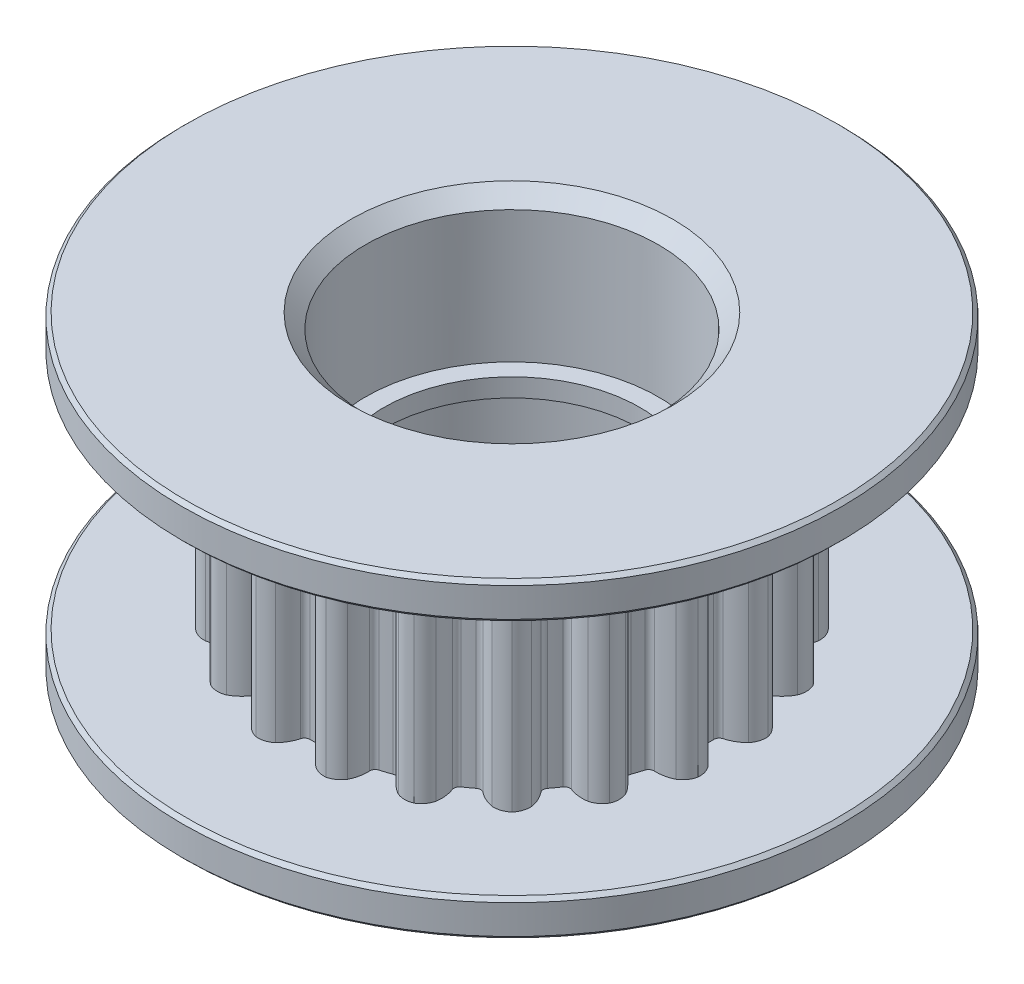
from build123d import *

# Parameters (mm, degrees)
GT2PROFILE_REACH             = 15.419
GT2PROFILE_DIRECTION_2_REACH = 15.419
GT2_GROOVE_CP_COUNT          = 20
INNERC_SIZE                  = 0.4
OUTERC_SIZE                  = 0.1


with BuildPart() as part:
    # BodyS → Body (revolve)
    with BuildSketch(Plane.XY):
        Polygon((6.11, -3.25), (6.11, 3.25), (9, 3.25), (9, 4.25), (4, 4.25), (4, 0.25), (3.5, 0.25), (3.5, -0.25), (4, -0.25), (4, -4.25), (9, -4.25), (9, -3.25), align=None)
    revolve(axis=Axis((0, 4.25, 0), (0, -1, 0)))

    # GT2Profile: up to this face of the body (flat: up to its plane)
    gt2profile_end = Plane(part.part.faces().sort_by_distance((-8.745441559, -3.25, 0))[0])
    # GT2ProfileS → GT2Profile (cut, up to the picked face)
    with BuildSketch(Plane(origin=(0, 0, 0), x_dir=(1, 0, 0), z_dir=(0, 1, 0)), mode=Mode.PRIVATE) as gt2profile_sk1:
        with BuildLine():
            ThreePointArc((0.299749921, -5.468781955), (0.244461347, -5.387479579), (0.150701934, -5.357881011))
            ThreePointArc((0.150701934, -5.357881011), (0, -5.36), (-0.150701934, -5.357881011))
            ThreePointArc((-0.150701934, -5.357881011), (-0.244461347, -5.387479579), (-0.299749921, -5.468781955))
            ThreePointArc((-0.299749921, -5.468781955), (-0.396626607, -5.703924717), (-0.549685833, -5.907025885))
            ThreePointArc((-0.549685833, -5.907025885), (-0.7593874, -6.016293358), (-0.995541542, -6.028349446))
            ThreePointArc((-0.995541542, -6.028349446), (0, -6.11), (0.995541542, -6.028349446))
            ThreePointArc((0.995541542, -6.028349446), (0.7593874, -6.016293358), (0.549685833, -5.907025885))
            ThreePointArc((0.549685833, -5.907025885), (0.396626607, -5.703924717), (0.299749921, -5.468781955))
        make_face()
    gt2profile_tool1 = split(extrude(gt2profile_sk1.sketch, amount=-GT2PROFILE_REACH, mode=Mode.PRIVATE), bisect_by=gt2profile_end, keep=Keep.BOTH, mode=Mode.PRIVATE)
    gt2profile = gt2profile_tool1.solids().sort_by(Axis((0, 0, 5.802237), (0, -1, 0)))[0]
    add(gt2profile, mode=Mode.SUBTRACT)

    # GT2Profile direction 2: up to this face of the body (flat: up to its plane)
    gt2profile_direction_2_end = Plane(part.part.faces().sort_by_distance((-6.364558441, 3.25, 0))[0])
    # GT2ProfileS → GT2Profile direction 2 (cut, up to the picked face)
    with BuildSketch(Plane(origin=(0, 0, 0), x_dir=(1, 0, 0), z_dir=(0, 1, 0)), mode=Mode.PRIVATE) as gt2profile_direction_2_sk1:
        with BuildLine():
            ThreePointArc((0.299749921, -5.468781955), (0.244461347, -5.387479579), (0.150701934, -5.357881011))
            ThreePointArc((0.150701934, -5.357881011), (0, -5.36), (-0.150701934, -5.357881011))
            ThreePointArc((-0.150701934, -5.357881011), (-0.244461347, -5.387479579), (-0.299749921, -5.468781955))
            ThreePointArc((-0.299749921, -5.468781955), (-0.396626607, -5.703924717), (-0.549685833, -5.907025885))
            ThreePointArc((-0.549685833, -5.907025885), (-0.7593874, -6.016293358), (-0.995541542, -6.028349446))
            ThreePointArc((-0.995541542, -6.028349446), (0, -6.11), (0.995541542, -6.028349446))
            ThreePointArc((0.995541542, -6.028349446), (0.7593874, -6.016293358), (0.549685833, -5.907025885))
            ThreePointArc((0.549685833, -5.907025885), (0.396626607, -5.703924717), (0.299749921, -5.468781955))
        make_face()
    gt2profile_direction_2_tool1 = split(extrude(gt2profile_direction_2_sk1.sketch, amount=GT2PROFILE_DIRECTION_2_REACH, mode=Mode.PRIVATE), bisect_by=gt2profile_direction_2_end, keep=Keep.BOTH, mode=Mode.PRIVATE)
    gt2profile_direction_2 = gt2profile_direction_2_tool1.solids().sort_by(Axis((0, 0, 5.802237), (0, 1, 0)))[0]
    add(gt2profile_direction_2, mode=Mode.SUBTRACT)

    # GT2 Groove CP: GT2Profile, GT2Profile direction 2 ×20 about axis
    gt2_groove_cp_axis = Axis((0, 4.25, 0), (0, 1, 0))
    add([gt2profile.rotate(gt2_groove_cp_axis, i * 360 / GT2_GROOVE_CP_COUNT) for i in range(1, GT2_GROOVE_CP_COUNT)], mode=Mode.SUBTRACT)
    add([gt2profile_direction_2.rotate(gt2_groove_cp_axis, i * 360 / GT2_GROOVE_CP_COUNT) for i in range(1, GT2_GROOVE_CP_COUNT)], mode=Mode.SUBTRACT)

    # InnerC
    innerc_edges = [part.edges().sort_by_distance(p)[0] for p in [
        (-4, -4.25, 0),
        (-4, 4.25, 0),
    ]]
    chamfer(innerc_edges, length=INNERC_SIZE)

    # OuterC
    outerc_edges = [part.edges().sort_by_distance(p)[0] for p in [
        (-9, -4.25, 0),
        (-9, -3.25, 0),
        (-9, 3.25, 0),
        (-9, 4.25, 0),
    ]]
    chamfer(outerc_edges, length=OUTERC_SIZE)


solid = part.part
